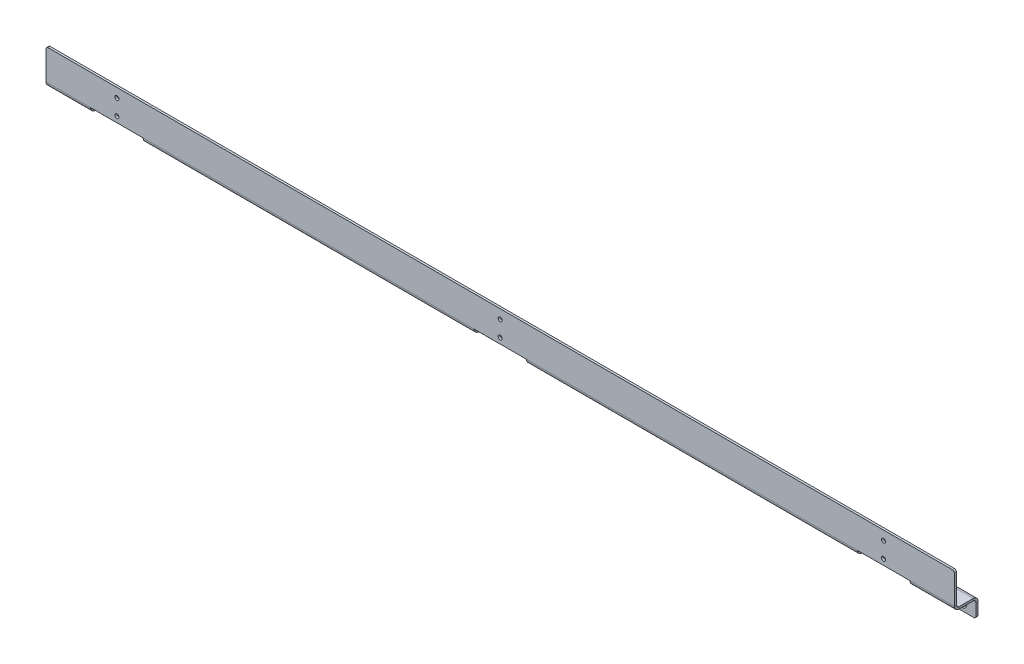
from build123d import *

# Parameters (mm, degrees)
BASE_FLANGE1_DEPTH                        = 1219.2
F_10_0_1935_DIAMETER_HOLE1_D              = 4.9149
HOLE_FOR_1_4_SELF_CLINCHING_NUTS_S_SS_C_D = 8.7376
SKETCH15_W                                = 38.1
SKETCH15_H                                = 22.86
CUT_EXTRUDE4_DEPTH                        = 5.76326
SKETCH16_W                                = 107.95
SKETCH16_H                                = 5.76326
SKETCH16_W_2                              = 171.45
CUT_EXTRUDE5_DEPTH                        = 1222.511012488
HOLE_FOR_1_4_SELF_CLINCHING_NUTS_S_2_D    = 8.7376
CUT_EXTRUDE7_REACH                        = 1224.598
SKETCH27_W                                = 63.5
SKETCH27_H                                = 26.035
SKETCH28_W                                = 60.325
SKETCH28_H                                = 58.95848
CUT_EXTRUDE8_DEPTH                        = 1223.597502808
SKETCH32_W                                = 38.1
SKETCH32_H                                = 5.76326
CUT_EXTRUDE9_DEPTH                        = 1055.864621408
SKETCH30_W                                = 1098.55
SKETCH30_H                                = 4.17576
BOSS_EXTRUDE1_DEPTH                       = 2.58826
FILLET1_R                                 = 2.54


# Read off the part's stored shape, not the designer's step: Base-Flange1
with BuildPart() as part:
    # Base-Flange1 outline → Base-Flange1 (new body)
    with BuildSketch(Plane(origin=(0, 0, 0), x_dir=(0, 0, -1), z_dir=(1, 0, 0))):
        with BuildLine():
            Line((61.49848, -47.625), (61.49848, -64.72174))
            Line((61.49848, -64.72174), (64.08674, -64.72174))
            Line((64.08674, -64.72174), (64.08674, -47.625))
            ThreePointArc((64.08674, -47.625), (62.398720228, -43.549759772), (58.32348, -41.86174))
            Line((58.32348, -41.86174), (41.275, -41.86174))
            ThreePointArc((41.275, -41.86174), (39.02993597, -40.93180403), (38.1, -38.68674))
            Line((38.1, -38.68674), (38.1, -5.76326))
            ThreePointArc((38.1, -5.76326), (36.411980228, -1.688019772), (32.33674, 0))
            Line((32.33674, 0), (0, 0))
            Line((0, 0), (0, -2.58826))
            Line((0, -2.58826), (32.33674, -2.58826))
            ThreePointArc((32.33674, -2.58826), (34.58180403, -3.51819597), (35.51174, -5.76326))
            Line((35.51174, -5.76326), (35.51174, -38.68674))
            ThreePointArc((35.51174, -38.68674), (37.199759772, -42.761980228), (41.275, -44.45))
            Line((41.275, -44.45), (58.32348, -44.45))
            ThreePointArc((58.32348, -44.45), (60.56854403, -45.37993597), (61.49848, -47.625))
        make_face()
    extrude(amount=BASE_FLANGE1_DEPTH)

    # #10 (0.1935) Diameter Hole1 (through all)
    with Locations(Plane(origin=(0, 0, -38.1), x_dir=(-1, 0, 0), z_dir=(0, 0, -1))):
        with Locations((-146.05, -12.7), (-609.6, -12.7), (-609.6, -31.75), (-1073.15, -12.7), (-1073.15, -31.75), (-146.05, -31.75)):
            Hole(F_10_0_1935_DIAMETER_HOLE1_D / 2)

    # Hole for 1_4 Self-clinching Nuts _S_SS_C (through all)
    with Locations(Plane(origin=(0, -2.58826, 0), x_dir=(-1, 0, 0), z_dir=(0, -1, 0))):
        with Locations((-304.8, 13.28674), (-914.4, 13.28674)):
            Hole(HOLE_FOR_1_4_SELF_CLINCHING_NUTS_S_SS_C_D / 2)

    # Sketch15 → Cut-Extrude4 (cut)
    with BuildSketch(Plane(origin=(0, 0, -64.08674), x_dir=(-1, 0, 0), z_dir=(0, 0, -1))):
        with Locations((-1200.15, -53.29174)):
            Rectangle(SKETCH15_W, SKETCH15_H)
        with Locations((-19.05, -53.29174)):
            Rectangle(SKETCH15_W, SKETCH15_H)
    extrude(amount=-CUT_EXTRUDE4_DEPTH, mode=Mode.SUBTRACT)

    # Sketch16 → Cut-Extrude5 (cut, through all)
    with BuildSketch(Plane(origin=(0, 0, -38.1), x_dir=(-1, 0, 0), z_dir=(0, 0, -1))):
        with Locations((-1165.225, -2.88163)):
            Rectangle(SKETCH16_W, SKETCH16_H)
        with Locations((-609.6, -2.88163)):
            Rectangle(SKETCH16_W_2, SKETCH16_H)
        with Locations((-53.975, -2.88163)):
            Rectangle(SKETCH16_W, SKETCH16_H)
    extrude(amount=-CUT_EXTRUDE5_DEPTH, mode=Mode.SUBTRACT)

    # Hole for 1_4 Self-clinching Nuts _S_ 2 (through all)
    with Locations(Plane(origin=(0, 0, -64.08674), x_dir=(-1, 0, 0), z_dir=(0, 0, -1))):
        with Locations((-1143, -56.78424), (-863.6, -56.78424), (-355.6, -56.78424), (-76.2, -56.78424)):
            Hole(HOLE_FOR_1_4_SELF_CLINCHING_NUTS_S_2_D / 2)

    # Cut-Extrude7: up to this face of the body (flat: up to its plane)
    cut_extrude7_end = Plane(part.part.faces().sort_by_distance((609.6, -22.225, -35.51174))[0])
    # Sketch27 → Cut-Extrude7 (cut, up to the picked face)
    with BuildSketch(Plane.XY.offset(-64.08674), mode=Mode.PRIVATE) as cut_extrude7_sk1:
        with Locations((146.05, -51.70424)):
            Rectangle(SKETCH27_W, SKETCH27_H)
    cut_extrude7_tool1 = split(extrude(cut_extrude7_sk1.sketch, amount=CUT_EXTRUDE7_REACH, mode=Mode.PRIVATE), bisect_by=cut_extrude7_end, keep=Keep.BOTH, mode=Mode.PRIVATE)
    # Sketch27 → Cut-Extrude7 (cut, up to the picked face)
    with BuildSketch(Plane.XY.offset(-64.08674), mode=Mode.PRIVATE) as cut_extrude7_sk2:
        with Locations((1073.15, -51.70424)):
            Rectangle(SKETCH27_W, SKETCH27_H)
    cut_extrude7_tool2 = split(extrude(cut_extrude7_sk2.sketch, amount=CUT_EXTRUDE7_REACH, mode=Mode.PRIVATE), bisect_by=cut_extrude7_end, keep=Keep.BOTH, mode=Mode.PRIVATE)
    # Sketch27 → Cut-Extrude7 (cut, up to the picked face)
    with BuildSketch(Plane.XY.offset(-64.08674), mode=Mode.PRIVATE) as cut_extrude7_sk3:
        with Locations((609.6, -51.70424)):
            Rectangle(SKETCH27_W, SKETCH27_H)
    cut_extrude7_tool3 = split(extrude(cut_extrude7_sk3.sketch, amount=CUT_EXTRUDE7_REACH, mode=Mode.PRIVATE), bisect_by=cut_extrude7_end, keep=Keep.BOTH, mode=Mode.PRIVATE)
    add(cut_extrude7_tool1.solids().sort_by(Axis((146.05, -51.70424, -64.08674), (0, 0, 1)))[0], mode=Mode.SUBTRACT)
    add(cut_extrude7_tool2.solids().sort_by(Axis((1073.15, -51.70424, -64.08674), (0, 0, 1)))[0], mode=Mode.SUBTRACT)
    add(cut_extrude7_tool3.solids().sort_by(Axis((609.6, -51.70424, -64.08674), (0, 0, 1)))[0], mode=Mode.SUBTRACT)

    # Sketch28 → Cut-Extrude8 (cut, through all)
    with BuildSketch(Plane(origin=(0, 0, -64.08674), x_dir=(-1, 0, 0), z_dir=(0, 0, -1))):
        with Locations((-1189.0375, -35.2425)):
            Rectangle(SKETCH28_W, SKETCH28_H)
        with Locations((-30.1625, -35.2425)):
            Rectangle(SKETCH28_W, SKETCH28_H)
    extrude(amount=-CUT_EXTRUDE8_DEPTH, mode=Mode.SUBTRACT)

    # Sketch32 → Cut-Extrude9 (cut, through all)
    with BuildSketch(Plane(origin=(1111.25, 0, 0), x_dir=(0, 0, -1), z_dir=(1, 0, 0))):
        with Locations((19.05, -2.88163)):
            Rectangle(SKETCH32_W, SKETCH32_H)
    extrude(amount=-CUT_EXTRUDE9_DEPTH, mode=Mode.SUBTRACT)

    # Sketch30 → Boss-Extrude1 (add)
    with BuildSketch(Plane(origin=(0, 0, -38.1), x_dir=(-1, 0, 0), z_dir=(0, 0, -1))):
        with Locations((-609.6, -3.67538)):
            Rectangle(SKETCH30_W, SKETCH30_H)
    extrude(amount=-BOSS_EXTRUDE1_DEPTH)

    # Fillet1
    fillet1_edges = [part.edges().sort_by_distance(p)[0] for p in [
        (1041.4, -64.72174, -62.79261),
        (1158.875, -1.5875, -36.80587),
        (60.325, -1.5875, -36.80587),
        (177.8, -64.72174, -62.79261),
        (60.325, -64.72174, -62.79261),
        (641.35, -64.72174, -62.79261),
        (1104.9, -64.72174, -62.79261),
        (1158.875, -64.72174, -62.79261),
        (114.3, -64.72174, -62.79261),
        (577.85, -64.72174, -62.79261),
    ]]
    fillet(fillet1_edges, radius=FILLET1_R)


solid = part.part
